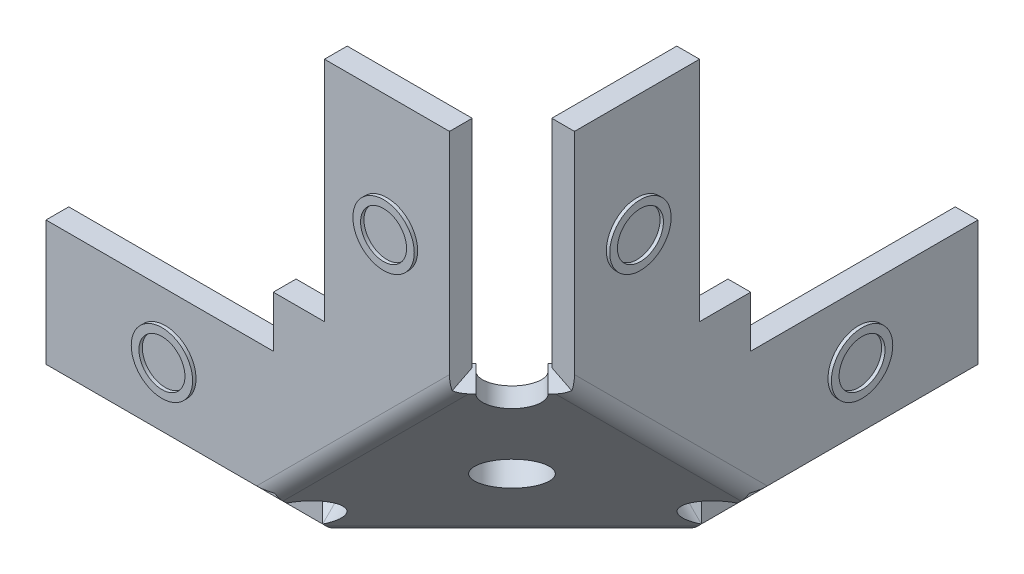
from build123d import *

# Parameters (mm, degrees)
BOSS_EXTRUDE1_DEPTH           = 0.5
SKETCH6_R                     = 1.1
BOSS_EXTRUDE3_DEPTH           = 1.5
BOSS_EXTRUDE3_TAPER           = 10
BOSS_EXTRUDE3_OTHER_WAY_DEPTH = 1.5
BOSS_EXTRUDE3_OTHER_WAY_TAPER = 10
CHAMFER1_SIZE                 = 0.24656061
CHAMFER1_SIZE_2               = 0.2
CIRPATTERN2_COUNT             = 2
CIRPATTERN2_ANGLE             = 270
CIRPATTERN3_COUNT             = 2
CIRPATTERN3_ANGLE             = 90
CUT_EXTRUDE8_DEPTH            = 33.330326321
CUT_EXTRUDE10_DEPTH           = 30.5
CUT_EXTRUDE11_DEPTH           = 33.330326321
SKETCH8_R                     = 1.35
SKETCH8_R_2                   = 1.01183651
BOSS_EXTRUDE4_DEPTH           = 0.15
SKETCH12_R                    = 1.35
SKETCH12_R_2                  = 1.01183651
BOSS_EXTRUDE5_DEPTH           = 0.15
SKETCH13_R                    = 1.35
SKETCH13_R_2                  = 1.01183651
BOSS_EXTRUDE6_DEPTH           = 0.15
SKETCH2_R                     = 1.35
BOSS_EXTRUDE2_DEPTH           = 1
FILLET1_R                     = 1
CUT_EXTRUDE2_DEPTH            = 34.638240887
CUT_EXTRUDE4_DEPTH            = 32.129266776
CUT_EXTRUDE6_DEPTH            = 4


with BuildPart() as part:
    # Sketch1 → Boss-Extrude1 (new, symmetric)
    with BuildSketch(Plane.XY):
        Polygon((-5, 2.75), (-5, 5), (-2.75, 5), (-2.75, 15), (2.75, 15), (2.75, 5), (-5, -2.75), (-15, -2.75), (-15, 2.75), align=None)
    extrude(amount=BOSS_EXTRUDE1_DEPTH, both=True)

    # Sketch6 → Boss-Extrude3 (add)
    with BuildSketch(Plane(origin=(0, -0.5, 0), x_dir=(-1, 0, 0), z_dir=(0, 0, -1))):
        with Locations((0, 10.25)):
            Circle(SKETCH6_R)
        with Locations((9.75, 0.5)):
            Circle(SKETCH6_R)
    extrude(amount=BOSS_EXTRUDE3_DEPTH, taper=BOSS_EXTRUDE3_TAPER)

    # Sketch6 → Boss-Extrude3 other way (add)
    with BuildSketch(Plane(origin=(0, -0.5, 0), x_dir=(-1, 0, 0), z_dir=(0, 0, -1))):
        with Locations((0, 10.25)):
            Circle(SKETCH6_R)
        with Locations((9.75, 0.5)):
            Circle(SKETCH6_R)
    extrude(amount=-BOSS_EXTRUDE3_OTHER_WAY_DEPTH, taper=BOSS_EXTRUDE3_OTHER_WAY_TAPER)

    # Chamfer1
    # the kernel refuses this chamfer: 0.24656061, 0.2 mm, written as the material it takes off along each edge
    with BuildSketch(Plane(origin=(0, 9.75, 1.5), x_dir=(-1, 0, 0), z_dir=(0, -1, 0))) as chamfer1_piece_1:
        Polygon((0.835509529 + CHAMFER1_SIZE * 0.173648177924, CHAMFER1_SIZE * 0.984807754467), (0.835509529 - CHAMFER1_SIZE_2, 0), (0.835509529, 0), align=None)
    revolve(axis=Axis((0, 9.75, 1.5), (0, 0, -1)), mode=Mode.SUBTRACT)
    with BuildSketch(Plane(origin=(0, 9.75, -1.5), x_dir=(-1, 0, 0), z_dir=(0, 1, 0))) as chamfer1_piece_2:
        Polygon((0.835509529 + CHAMFER1_SIZE_2 * 0.173648177667, CHAMFER1_SIZE_2 * 0.984807753012), (0.835509529 - CHAMFER1_SIZE * 1.00000000148, 0), (0.835509529, 0), align=None)
    revolve(axis=Axis((0, 9.75, -1.5), (0, 0, 1)), mode=Mode.SUBTRACT)
    with BuildSketch(Plane(origin=(-9.75, 0, 1.5), x_dir=(-1, 0, 0), z_dir=(0, -1, 0))) as chamfer1_piece_3:
        Polygon((0.835509529 + CHAMFER1_SIZE * 0.173648177924, CHAMFER1_SIZE * 0.984807754467), (0.835509529 - CHAMFER1_SIZE_2, 0), (0.835509529, 0), align=None)
    revolve(axis=Axis((-9.75, 0, 1.5), (0, 0, -1)), mode=Mode.SUBTRACT)
    with BuildSketch(Plane(origin=(-9.75, 0, -1.5), x_dir=(-1, 0, 0), z_dir=(0, 1, 0))) as chamfer1_piece_4:
        Polygon((0.835509529 + CHAMFER1_SIZE_2 * 0.173648177667, CHAMFER1_SIZE_2 * 0.984807753012), (0.835509529 - CHAMFER1_SIZE * 1.00000000148, 0), (0.835509529, 0), align=None)
    revolve(axis=Axis((-9.75, 0, -1.5), (0, 0, 1)), mode=Mode.SUBTRACT)


with BuildPart() as cirpattern2_1:
    # CirPattern2: pattern copy
    add(part.part.rotate(Axis((0, -5, 0), (1, 0, 0)), 1 * CIRPATTERN2_ANGLE / (CIRPATTERN2_COUNT - 1)))

    # Sketch9 → Cut-Extrude8 (cut, through all)
    with BuildSketch(Plane.XZ.offset(5.5)):
        Polygon((-5, -10), (-2.75, -10), (-2.75, -20), (2.75, -20), (2.75, -10), (-5, -2.25), (-15, -2.25), (-15, -7.75), (-5, -7.75), align=None)
    extrude(amount=CUT_EXTRUDE8_DEPTH, mode=Mode.SUBTRACT)

    # Sketch12 → Boss-Extrude5 (add)
    # profile 1 of 2: a face of its own
    with BuildSketch(Plane.XZ.offset(5.5)):
        with Locations(Location((-9.75, -5, 0), (0, 0, 270))):
            Circle(SKETCH12_R)
        with Locations(Location((-9.75, -5, 0), (0, 0, 270))):
            Circle(SKETCH12_R_2, mode=Mode.SUBTRACT)
    # profile 2 of 2: a face of its own
    with BuildSketch(Plane.XZ.offset(5.5)):
        with Locations(Location((0, -14.75, 0), (0, 0, 270))):
            Circle(SKETCH12_R)
        with Locations(Location((0, -14.75, 0), (0, 0, 270))):
            Circle(SKETCH12_R_2, mode=Mode.SUBTRACT)
    extrude(amount=BOSS_EXTRUDE5_DEPTH)


with BuildPart() as cirpattern3_1:
    # CirPattern3: pattern copy
    add(part.part.rotate(Axis((5, 0, 0), (0, -1, 0)), 1 * CIRPATTERN3_ANGLE / (CIRPATTERN3_COUNT - 1)))

    # Sketch11 → Cut-Extrude11 (cut, through all)
    with BuildSketch(Plane(origin=(5.5, 0, 0), x_dir=(0, 0, -1), z_dir=(1, 0, 0))):
        Polygon((10, 5), (7.75, 5), (7.75, 15), (2.25, 15), (2.25, 5), (10, -2.75), (20, -2.75), (20, 2.75), (10, 2.75), align=None)
    extrude(amount=CUT_EXTRUDE11_DEPTH, mode=Mode.SUBTRACT)

    # Sketch13 → Boss-Extrude6 (add)
    # profile 1 of 2: a face of its own
    with BuildSketch(Plane(origin=(5.5, 0, 0), x_dir=(0, 0, -1), z_dir=(1, 0, 0))):
        with Locations((14.75, 0)):
            Circle(SKETCH13_R)
        with Locations((14.75, 0)):
            Circle(SKETCH13_R_2, mode=Mode.SUBTRACT)
    # profile 2 of 2: a face of its own
    with BuildSketch(Plane(origin=(5.5, 0, 0), x_dir=(0, 0, -1), z_dir=(1, 0, 0))):
        with Locations((5, 9.75)):
            Circle(SKETCH13_R)
        with Locations((5, 9.75)):
            Circle(SKETCH13_R_2, mode=Mode.SUBTRACT)
    extrude(amount=BOSS_EXTRUDE6_DEPTH)


with BuildPart() as part_1:
    add(part.part)

    # Sketch10 → Cut-Extrude10 (cut, through all)
    with BuildSketch(Plane.XY.offset(0.5)):
        Polygon((-2.75, 5), (-5, 5), (-5, 2.75), (-15, 2.75), (-15, -2.75), (-5, -2.75), (2.75, 5), (2.75, 15), (-2.75, 15), align=None)
    extrude(amount=CUT_EXTRUDE10_DEPTH, mode=Mode.SUBTRACT)

    # Sketch8 → Boss-Extrude4 (add)
    # profile 1 of 2: a face of its own
    with BuildSketch(Plane.XY.offset(0.5)):
        with Locations(Location((-9.75, 0, 0), (0, 0, 180))):
            Circle(SKETCH8_R)
        with Locations((-9.75, 0)):
            Circle(SKETCH8_R_2, mode=Mode.SUBTRACT)
    # profile 2 of 2: a face of its own
    with BuildSketch(Plane.XY.offset(0.5)):
        with Locations(Location((0, 9.75, 0), (0, 0, 180))):
            Circle(SKETCH8_R)
        with Locations((0, 9.75)):
            Circle(SKETCH8_R_2, mode=Mode.SUBTRACT)
    extrude(amount=BOSS_EXTRUDE4_DEPTH)

    add(cirpattern2_1.part)  # Boss-Extrude2 merges CirPattern2_1

    add(cirpattern3_1.part)  # Boss-Extrude2 merges CirPattern3_1
    # Sketch2 → Boss-Extrude2 (add)
    with BuildSketch(Plane(origin=(-0.583333333, 0.583333333, -0.583333333), x_dir=(0.8164965809277334, 0.4082482904638652, -0.40824829046384614), z_dir=(-0.5773502691896154, 0.5773502691896445, -0.5773502691896175))):
        Polygon((7.450531301, 9.01561146), (7.450531301, -1.944543648), (4.082482905, -3.889087297), (-5.409289849, 1.590990258), (-5.409289849, 5.480077554), (4.082482905, 10.960155108), align=None)
        with Locations(Location((2.041241452, 3.535533906, 0), (0, 0, 270))):
            Circle(SKETCH2_R, mode=Mode.SUBTRACT)
    extrude(amount=BOSS_EXTRUDE2_DEPTH)

    # Fillet1
    fillet1_edges = [part_1.edges().sort_by_distance(p)[0] for p in [
        (-1.125, 1.125, 0.5),
        (-1.125, -5.5, -6.125),
        (5.5, 1.125, -6.125),
    ]]
    fillet(fillet1_edges, radius=FILLET1_R)

    # Sketch3 → Cut-Extrude2 (cut, through all)
    with BuildSketch(Plane(origin=(4.125, -4.125, 0), x_dir=(0.7071067811865475, 0.7071067811865477, -2.769222492809729e-15), z_dir=(-0.7071067811865477, 0.7071067811865475, -2.769222492809729e-15))):
        with BuildLine():
            Line((1.125, 10), (1.125, 11.125))
            Line((1.125, 11.125), (-1.125, 11.125))
            Line((-1.125, 11.125), (-1.125, 10))
            ThreePointArc((-1.125, 10), (0, 8.875), (1.125, 10))
        make_face()
    extrude(amount=CUT_EXTRUDE2_DEPTH, mode=Mode.SUBTRACT)

    # Sketch4 → Cut-Extrude4 (cut, through all)
    with BuildSketch(Plane(origin=(1.625, 0, 1.625), x_dir=(-0.7071067811865487, 2.4677036874675166e-14, 0.7071067811865465), z_dir=(-0.7071067811865465, -2.4677036874675254e-14, -0.7071067811865487))):
        with BuildLine():
            Line((-2.410533906, 5), (-2.410533906, 6.125))
            Line((-2.410533906, 6.125), (-4.660533906, 6.125))
            Line((-4.660533906, 6.125), (-4.660533906, 5))
            ThreePointArc((-4.660533906, 5), (-3.535533906, 3.875), (-2.410533906, 5))
        make_face()
    extrude(amount=CUT_EXTRUDE4_DEPTH, mode=Mode.SUBTRACT)

    # Sketch5 → Cut-Extrude6 (cut)
    with BuildSketch(Plane(origin=(0, -1.625, 1.625), x_dir=(-1, 0, 0), z_dir=(-5.877305542968418e-15, 0.7071067811865465, -0.7071067811865486))):
        with BuildLine():
            Line((5, -4.660533906), (6.125, -4.660533906))
            Line((6.125, -4.660533906), (6.125, -2.410533906))
            Line((6.125, -2.410533906), (5, -2.410533906))
            ThreePointArc((5, -2.410533906), (3.875, -3.535533906), (5, -4.660533906))
        make_face()
    extrude(amount=CUT_EXTRUDE6_DEPTH, mode=Mode.SUBTRACT)


solid = part_1.part
